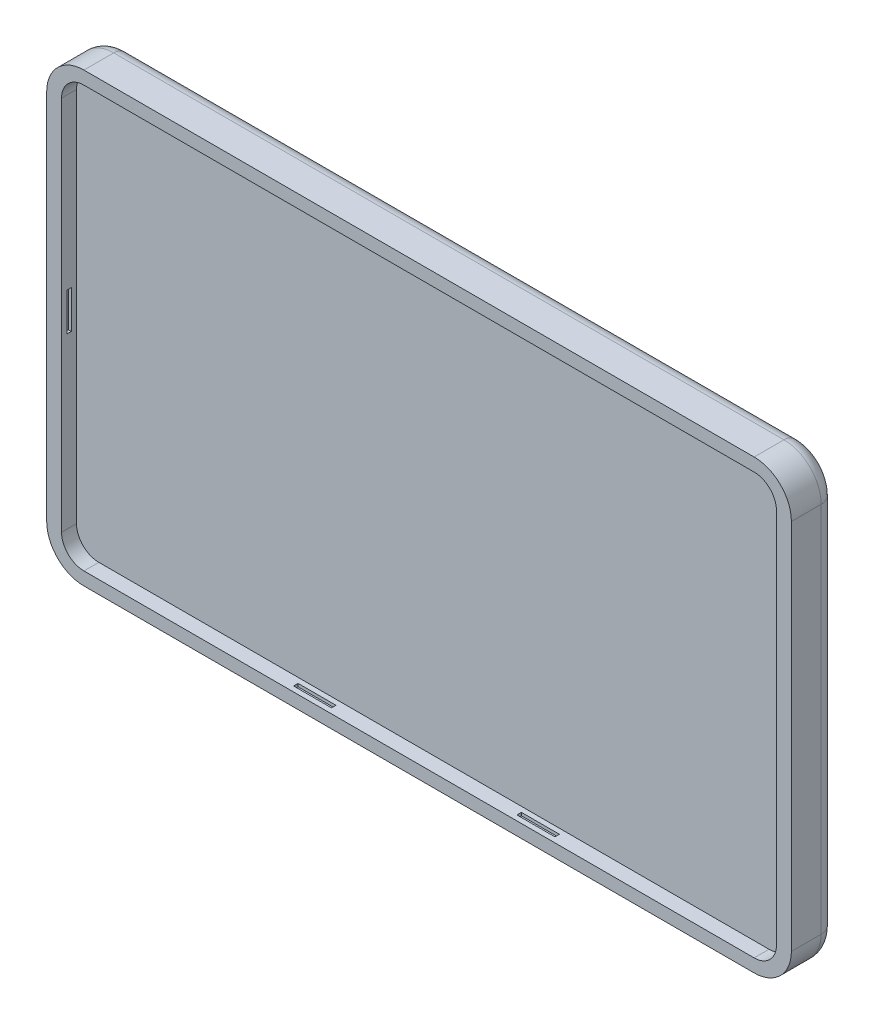
from build123d import *

# Parameters (mm, degrees)
SKETCH_1_W          = 100
SKETCH_1_H          = 60
EXTRUDE_1_DEPTH     = 6
FILLET_1_R          = 5
FILLET_2_R          = 2
CUT_EXTRUDE_1_DEPTH = 2
SKETCH_4_W          = 5.1
SKETCH_4_H          = 0.6
CUT_EXTRUDE_2_DEPTH = 0.4
SKETCH_5_W          = 5.1
SKETCH_5_H          = 0.6
CUT_EXTRUDE_3_DEPTH = 0.4
SKETCH_6_W          = 0.6
SKETCH_6_H          = 5.1
CUT_EXTRUDE_4_DEPTH = 0.4
SKETCH_7_W          = 0.6
SKETCH_7_H          = 5.1
CUT_EXTRUDE_5_DEPTH = 0.4


with BuildPart() as part:
    # 草图1 → 凸台-拉伸1 (new body)
    with BuildSketch(Plane.XY):
        Rectangle(SKETCH_1_W, SKETCH_1_H)
    extrude(amount=EXTRUDE_1_DEPTH)

    # 圆角1
    fillet_1_edges = [part.edges().sort_by_distance(p)[0] for p in [
        (-50, -30, 3),
        (50, -30, 3),
        (50, 30, 3),
        (-50, 30, 3),
    ]]
    fillet(fillet_1_edges, radius=FILLET_1_R)

    # 圆角2
    fillet_2_edges = [part.edges().sort_by_distance(p)[0] for p in [
        (48.535533906, -28.535533906, 0),
        (50, 0, 0),
        (48.535533906, 28.535533906, 0),
        (0, 30, 0),
        (-48.535533906, 28.535533906, 0),
        (-50, 0, 0),
        (-48.535533906, -28.535533906, 0),
        (0, -30, 0),
    ]]
    fillet(fillet_2_edges, radius=FILLET_2_R)

    # 草图2 → 切除-拉伸1 (cut)
    with BuildSketch(Plane.XY.offset(6)):
        with BuildLine():
            Line((-45, 28.25), (45, 28.25))
            ThreePointArc((45, 28.25), (47.121320344, 27.371320344), (48, 25.25))
            Line((48, 25.25), (48, -25.25))
            ThreePointArc((48, -25.25), (47.121320344, -27.371320344), (45, -28.25))
            Line((45, -28.25), (-45, -28.25))
            ThreePointArc((-45, -28.25), (-47.121320344, -27.371320344), (-48, -25.25))
            Line((-48, -25.25), (-48, 25.25))
            ThreePointArc((-48, 25.25), (-47.121320344, 27.371320344), (-45, 28.25))
        make_face()
    extrude(amount=-CUT_EXTRUDE_1_DEPTH, mode=Mode.SUBTRACT)

    # 草图4 → 切除-拉伸2 (cut)
    with BuildSketch(Plane(origin=(0, -28.25, 0), x_dir=(1, 0, 0), z_dir=(0, 1, 0))):
        with Locations((15, -5)):
            Rectangle(SKETCH_4_W, SKETCH_4_H)
        with Locations((-15, -5)):
            Rectangle(SKETCH_4_W, SKETCH_4_H)
    extrude(amount=-CUT_EXTRUDE_2_DEPTH, mode=Mode.SUBTRACT)

    # 草图5 → 切除-拉伸3 (cut)
    with BuildSketch(Plane.XZ.offset(-28.25)):
        with Locations((-15, 5)):
            Rectangle(SKETCH_5_W, SKETCH_5_H)
        with Locations((15, 5)):
            Rectangle(SKETCH_5_W, SKETCH_5_H)
    extrude(amount=-CUT_EXTRUDE_3_DEPTH, mode=Mode.SUBTRACT)

    # 草图6 → 切除-拉伸4 (cut)
    with BuildSketch(Plane(origin=(-48, 0, 0), x_dir=(0, 0, -1), z_dir=(1, 0, 0))):
        with Locations((-5, 0)):
            Rectangle(SKETCH_6_W, SKETCH_6_H)
    extrude(amount=-CUT_EXTRUDE_4_DEPTH, mode=Mode.SUBTRACT)

    # 草图7 → 切除-拉伸5 (cut)
    with BuildSketch(Plane.ZY.offset(-48)):
        with Locations((5, 0)):
            Rectangle(SKETCH_7_W, SKETCH_7_H)
    extrude(amount=-CUT_EXTRUDE_5_DEPTH, mode=Mode.SUBTRACT)


solid = part.part
